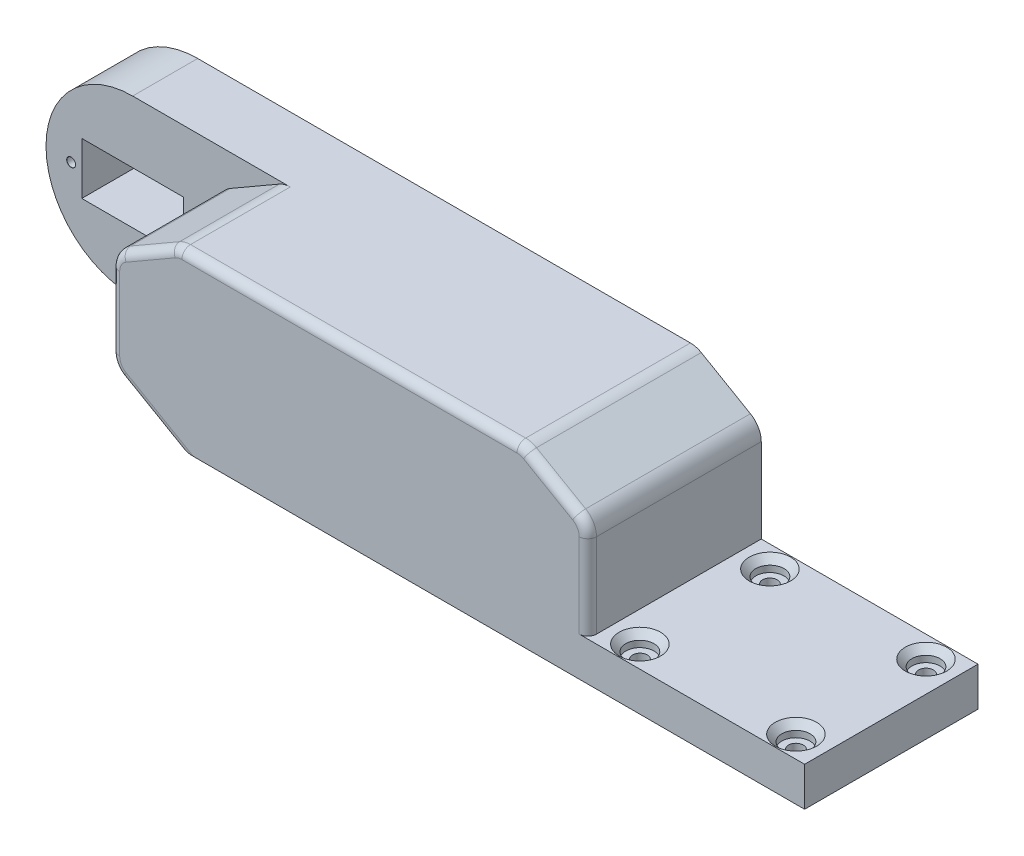
from build123d import *

# Parameters (mm, degrees)
BOSS_EXTRUDE1_DEPTH                        = 40
CUT_EXTRUDE2_DEPTH                         = 25
CUT_EXTRUDE4_DEPTH                         = 208.846096908
F_2_0MM_DOWEL_HOLE1_D                      = 2
F_2_0MM_DOWEL_HOLE1_DEPTH                  = 9
F_2_0MM_DOWEL_HOLE1_CSINK_D                = 2.05
F_2_0MM_DOWEL_HOLE1_CSINK_ANGLE            = 90
F_2_0MM_DOWEL_HOLE1_TIP                    = 0.600860619
SKETCH11_W                                 = 23.5
SKETCH11_H                                 = 12
CUT_EXTRUDE3_DEPTH                         = 206.48722588
FILLET7_R                                  = 5
FILLET6_R                                  = 2
CBORE_FOR_M5_CHEESE_HEAD_SCREW1_AT_2_COUNT = 2
CBORE_FOR_M5_CHEESE_HEAD_SCREW1_AT_2_PITCH = 36
CBORE_FOR_M5_CHEESE_HEAD_SCREW1_AT_3_COUNT = 2
CBORE_FOR_M5_CHEESE_HEAD_SCREW1_AT_3_PITCH = 30
CBORE_FOR_M5_CHEESE_HEAD_SCREW1_AT_4_COUNT = 2
CBORE_FOR_M5_CHEESE_HEAD_SCREW1_AT_4_PITCH = 46.861498055
FILLET8_R                                  = 20


with BuildPart() as part:
    # Sketch1 → Boss-Extrude1 (new body)
    with BuildSketch(Plane.XY):
        Polygon((0, 0), (-200, 0), (-200, 40), (-50, 40), (-50, 9), (0, 9), align=None)
    extrude(amount=BOSS_EXTRUDE1_DEPTH)

    # Sketch5 → Cut-Extrude2 (cut)
    with BuildSketch(Plane.XY.offset(40)):
        Polygon((-145, 40), (-160, 31.339745962), (-160, 8.660254038), (-145, 0), (-200, 0), (-200, 40), align=None)
    extrude(amount=-CUT_EXTRUDE2_DEPTH, mode=Mode.SUBTRACT)

    # Sketch13 → Cut-Extrude4 (cut, through all)
    with BuildSketch(Plane.XY.offset(40)):
        Polygon((-50, 31.339745962), (-65, 40), (-50, 40), align=None)
    extrude(amount=-CUT_EXTRUDE4_DEPTH, mode=Mode.SUBTRACT)

    # Ø2.0mm Dowel Hole1
    with Locations(Plane.XY.offset(15)):
        with Locations((-194.2, 19.664446974), (-165.8, 19.664446974)):
            CounterSinkHole(F_2_0MM_DOWEL_HOLE1_D / 2, F_2_0MM_DOWEL_HOLE1_CSINK_D / 2, depth=F_2_0MM_DOWEL_HOLE1_DEPTH, counter_sink_angle=F_2_0MM_DOWEL_HOLE1_CSINK_ANGLE)
            with Locations((0, 0, -(F_2_0MM_DOWEL_HOLE1_DEPTH + F_2_0MM_DOWEL_HOLE1_TIP / 2))):  # 118° drill point
                Cone(0, F_2_0MM_DOWEL_HOLE1_D / 2, F_2_0MM_DOWEL_HOLE1_TIP, mode=Mode.SUBTRACT)

    # Sketch11 → Cut-Extrude3 (cut, through all)
    with BuildSketch(Plane.XY.offset(15)):
        with Locations((-180, 19.664446974)):
            Rectangle(SKETCH11_W, SKETCH11_H)
    extrude(amount=-CUT_EXTRUDE3_DEPTH, mode=Mode.SUBTRACT)

    # Fillet7
    fillet7_edges = [part.edges().sort_by_distance(p)[0] for p in [
        (-145, 40, 27.5),
        (-160, 31.339745962, 27.5),
        (-160, 8.660254038, 27.5),
        (-50, 31.339745962, 20),
        (-65, 40, 20),
    ]]
    fillet(fillet7_edges, radius=FILLET7_R)

    # Fillet6
    fillet6_edges = [part.edges().sort_by_distance(p)[0] for p in [
        (-50, 18.726497308, 40),
        (-151.25, 3.608439182, 40),
        (-58.169872981, 36.056624327, 40),
        (-105, 40, 40),
        (-151.830127019, 36.056624327, 40),
        (-160, 20, 40),
        (-159.330127019, 30.952994616, 40),
        (-159.330127019, 9.047005384, 40),
        (-144.954349263, 39.829629131, 40),
        (-50.669872981, 30.952994616, 40),
        (-65.045650737, 39.829629131, 40),
    ]]
    fillet(fillet6_edges, radius=FILLET6_R)

    # Sketch3 → CBORE for M5 Cheese Head Screw1 (revolve, cut)
    with BuildSketch(Plane(origin=(-43, 9, 5), x_dir=(0, 0, 1), z_dir=(1, 0, 0))):
        Polygon((0, 0), (0, 9), (1.7, 9), (1.7, 3), (3.25, 3), (3.25, 1.525), (4.775, 0), align=None)
    cbore_for_m5_cheese_head_screw1 = revolve(axis=Axis((-43, 15.35, 5), (0, -1, 0)), mode=Mode.SUBTRACT)

    # CBORE for M5 Cheese Head Screw1 at 2: CBORE for M5 Cheese Head Screw1 ×2
    with Locations(*[(i * CBORE_FOR_M5_CHEESE_HEAD_SCREW1_AT_2_PITCH, 0, 0) for i in range(1, CBORE_FOR_M5_CHEESE_HEAD_SCREW1_AT_2_COUNT)]):
        add(cbore_for_m5_cheese_head_screw1, mode=Mode.SUBTRACT)

    # CBORE for M5 Cheese Head Screw1 at 3: CBORE for M5 Cheese Head Screw1 ×2
    with Locations(*[(0, 0, i * CBORE_FOR_M5_CHEESE_HEAD_SCREW1_AT_3_PITCH) for i in range(1, CBORE_FOR_M5_CHEESE_HEAD_SCREW1_AT_3_COUNT)]):
        add(cbore_for_m5_cheese_head_screw1, mode=Mode.SUBTRACT)

    # CBORE for M5 Cheese Head Screw1 at 4: CBORE for M5 Cheese Head Screw1 ×2
    with Locations(*[Vector(0.7682212795973759, 0, 0.6401843996644799) * (i * CBORE_FOR_M5_CHEESE_HEAD_SCREW1_AT_4_PITCH) for i in range(1, CBORE_FOR_M5_CHEESE_HEAD_SCREW1_AT_4_COUNT)]):
        add(cbore_for_m5_cheese_head_screw1, mode=Mode.SUBTRACT)

    # Fillet8
    fillet8_edges = [part.edges().sort_by_distance(p)[0] for p in [
        (-200, 0, 7.5),
        (-200, 40, 7.5),
    ]]
    fillet(fillet8_edges, radius=FILLET8_R - 0.0001)  # a hair under: the kernel refuses the full size


solid = part.part
